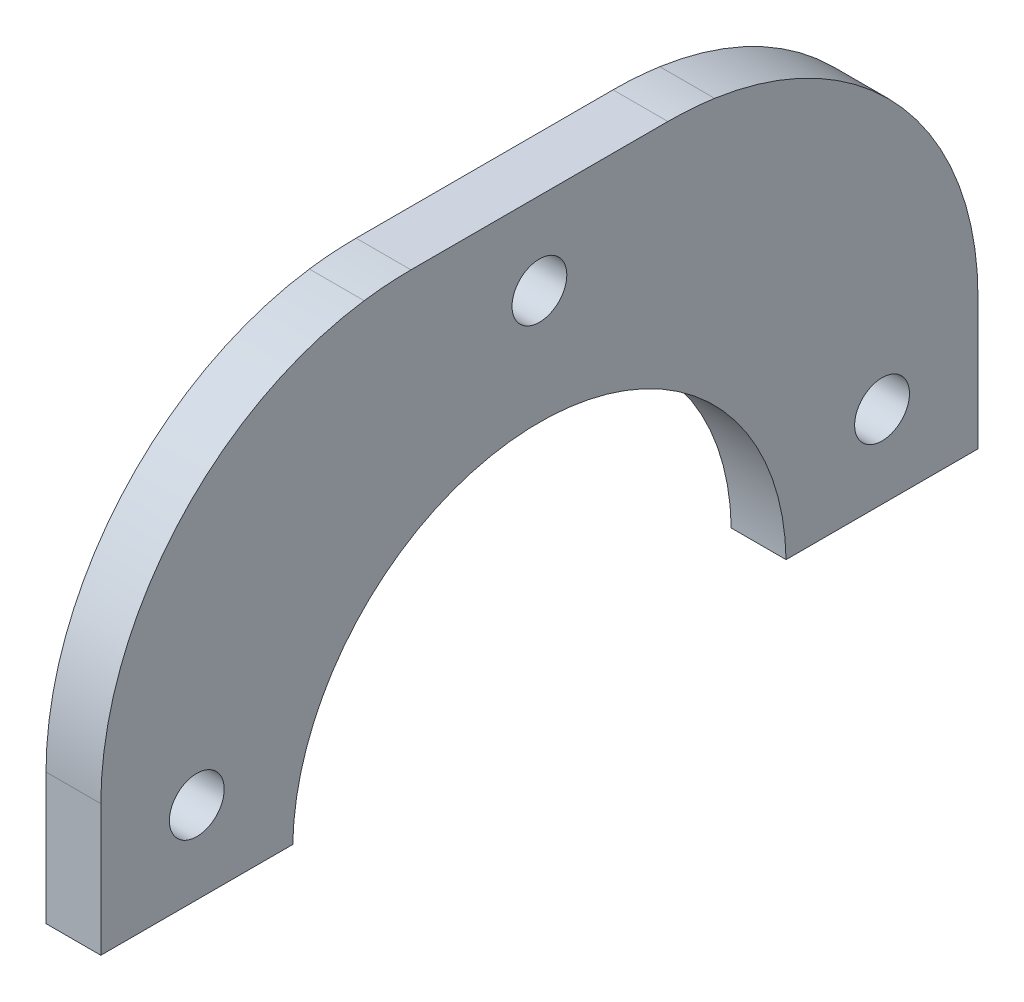
from build123d import *

# Parameters (mm, degrees)
BOSS_EXTRUDE1_DEPTH              = 3.175
SKETCH2_R                        = 14.2875
CUT_EXTRUDE1_DEPTH               = 29.575
F_1_8_0_125_DIAMETER_HOLE1_D     = 3.175
F_1_8_0_125_DIAMETER_HOLE1_DEPTH = 19.001994
F_1_8_0_125_DIAMETER_HOLE1_TIP   = 0.953866233
FILLET1_R                        = 17.78


with BuildPart() as part:
    # Sketch1 → Boss-Extrude1 (new body)
    with BuildSketch(Plane(origin=(0, 0, 0), x_dir=(0, 0, -1), z_dir=(1, 0, 0))):
        with BuildLine():
            Line((-25.4, -12.7), (25.4, -12.7))
            Line((25.4, -12.7), (25.4, 0))
            ThreePointArc((25.4, 0), (18.438010386, 9.204259867), (7.439487758, 12.7))
            Line((7.439487758, 12.7), (-7.439487758, 12.7))
            ThreePointArc((-7.439487758, 12.7), (-18.438010386, 9.204259867), (-25.4, 0))
            Line((-25.4, 0), (-25.4, -12.7))
        make_face()
    extrude(amount=BOSS_EXTRUDE1_DEPTH)

    # Sketch2 → Cut-Extrude1 (cut, through all)
    with BuildSketch(Plane(origin=(3.175, 0, 0), x_dir=(0, 0, -1), z_dir=(1, 0, 0))):
        with Locations((0, -12.954)):
            Circle(SKETCH2_R)
    extrude(amount=-CUT_EXTRUDE1_DEPTH, mode=Mode.SUBTRACT)

    # 1/8 (0.125) Diameter Hole1
    with Locations(Plane(origin=(3.175, 0, 0), x_dir=(0, 0, -1), z_dir=(1, 0, 0))):
        with Locations((-19.842621022, -7.9375), (0, 7.9375), (19.842621022, -7.9375)):
            Hole(F_1_8_0_125_DIAMETER_HOLE1_D / 2, depth=F_1_8_0_125_DIAMETER_HOLE1_DEPTH)
            with Locations((0, 0, -(F_1_8_0_125_DIAMETER_HOLE1_DEPTH + F_1_8_0_125_DIAMETER_HOLE1_TIP / 2))):  # 118° drill point
                Cone(0, F_1_8_0_125_DIAMETER_HOLE1_D / 2, F_1_8_0_125_DIAMETER_HOLE1_TIP, mode=Mode.SUBTRACT)

    # Fillet1
    fillet1_edges = [part.edges().sort_by_distance(p)[0] for p in [
        (1.5875, 0, 25.4),
        (1.5875, 0, -25.4),
    ]]
    fillet(fillet1_edges, radius=FILLET1_R)


solid = part.part
